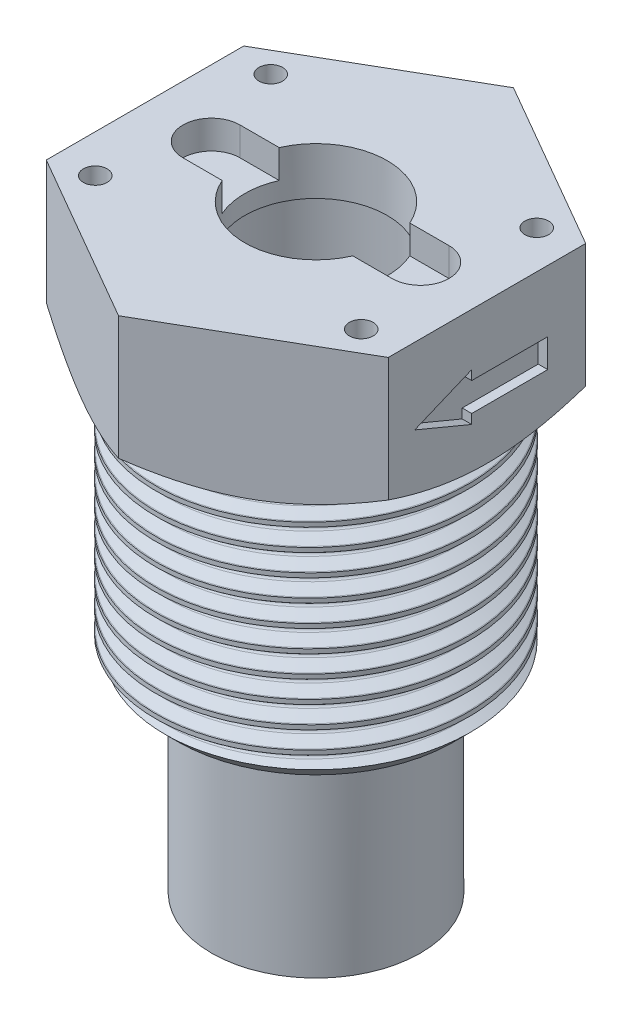
from build123d import *

# Parameters (mm, degrees)
SKETCH_1_W             = 11
SKETCH_1_H             = 65
SKETCH_8_R             = 18.027171515
CUT_EXTRUDE_8_DEPTH    = 2
SKETCH_10_R            = 9.5
CUT_EXTRUDE_10_DEPTH   = 58
SKETCH_11_R            = 7.5
CUT_EXTRUDE_11_DEPTH   = 6
SKETCH_25_R            = 9.5
EXTRUDE_4_DEPTH        = 15
WRAP_START             = -33
WRAP_1_DEPTH           = 1
SKETCH_20_R            = 16.5
SKETCH_20_R_2          = 11
EXTRUDE_3_DEPTH        = 27
CHAMFER_1_SIZE         = 2
SWEEP_2_PITCH          = 2.309
CUT_EXTRUDE_12_DEPTH   = 3
HOLE_WIZARD_M3_1_D     = 2.5
HOLE_WIZARD_M3_1_DEPTH = 10.5
HOLE_WIZARD_M3_1_TIP   = 0.751075774


# Read off the part's stored shape, not the designer's step: 包覆1
with BuildPart() as part:
    # 草图1 → 旋转1 (revolve)
    with BuildSketch(Plane.XY, mode=Mode.PRIVATE) as revolve_1_sk:
        with Locations((5.5, 32.5)):
            Rectangle(SKETCH_1_W, SKETCH_1_H)
    revolve(revolve_1_sk.sketch.rotate(Axis((0, 65, 0), (0, -1, 0)), 180), axis=Axis((0, 65, 0), (0, -1, 0)))

    # 草图8 → 切除-拉伸8 (cut)
    with BuildSketch(Plane.XZ):
        Circle(SKETCH_8_R)
    extrude(amount=-CUT_EXTRUDE_8_DEPTH, mode=Mode.SUBTRACT)

    # 草图10 → 切除-拉伸10 (cut)
    with BuildSketch(Plane.XZ.offset(-2)):
        Circle(SKETCH_10_R)
    extrude(amount=-CUT_EXTRUDE_10_DEPTH, mode=Mode.SUBTRACT)

    # 草图11 → 切除-拉伸11 (cut)
    with BuildSketch(Plane(origin=(0, 65, 0), x_dir=(1, 0, 0), z_dir=(0, 1, 0))):
        with Locations(Location((0, 0, 0), (0, 0, 180))):
            Circle(SKETCH_11_R)
    extrude(amount=-CUT_EXTRUDE_11_DEPTH, mode=Mode.SUBTRACT)

    # 草图25 → 凸台-拉伸4 (add)
    with BuildSketch(Plane(origin=(0, 50, 0), x_dir=(1, 0, 0), z_dir=(0, 1, 0))):
        Polygon((0, 20.784609691), (-18, 10.392304845), (-18, -10.392304845), (0, -20.784609691), (18, -10.392304845), (18, 10.392304845), align=None)
        Circle(SKETCH_25_R, mode=Mode.SUBTRACT)
    extrude(amount=EXTRUDE_4_DEPTH)

    # 包覆1 outline → 包覆1 (cut)
    with BuildSketch(Plane(origin=(50, 0, 0), x_dir=(0, 0, -1), z_dir=(1, 0, 0)).offset(WRAP_START)):
        Polygon((-7.607695155, 57), (-1.607695155, 54.5), (-1.607695155, 55.5), (6.392304845, 55.5), (6.392304845, 58.5), (-1.607695155, 58.5), (-1.607695155, 59.5), align=None)
    wrap_1 = extrude(amount=WRAP_1_DEPTH, mode=Mode.SUBTRACT)

    # 镜向1: 包覆1 across plane
    add(wrap_1.mirror(Plane(origin=(0, 0, 0), x_dir=(0, 0, 1), z_dir=(1, 0, 0))), mode=Mode.SUBTRACT)

    # 草图20 → 凸台-拉伸3 (add)
    with BuildSketch(Plane(origin=(0, 50, 0), x_dir=(1, 0, 0), z_dir=(0, 1, 0))):
        with Locations(Location((0, 0, 0), (0, 0, 270))):
            Circle(SKETCH_20_R)
        with Locations(Location((0, 0, 0), (0, 0, 270))):
            Circle(SKETCH_20_R_2, mode=Mode.SUBTRACT)
    extrude(amount=-EXTRUDE_3_DEPTH)

    # 草图21 → 切除-旋转2 (revolve, cut)
    with BuildSketch(Plane(origin=(0, 0, 0), x_dir=(0, 0, -1), z_dir=(1, 0, 0)), mode=Mode.PRIVATE) as cut_revolve_2_sk:
        Polygon((20.784609691, 52), (20.784609691, 50), (17.784609691, 50), align=None)
    revolve(cut_revolve_2_sk.sketch.rotate(Axis((0, 52, 0), (0, 1, 0)), 180), axis=Axis((0, 52, 0), (0, 1, 0)), mode=Mode.SUBTRACT)

    # 倒角1
    chamfer_1_edges = [part.edges().sort_by_distance(p)[0] for p in [
        (0, 23, -16.5),
    ]]
    chamfer(chamfer_1_edges, length=CHAMFER_1_SIZE)

    # 切除-扫描2: the profile of 草图24 screwed along a right-hand helix of 12 turns, 10 arcs to a turn; built about Z, then put on its axis
    sweep_2_z = Axis((0, 0, 0), (0, 0, 1))
    sweep_2_corners = [(16.42937431, 0, -0.590182434), (15.292853797, 0, -1.181817566), (15.122228107, 0, -1.463), (15.292853797, 0, -1.744182434), (16.42937431, 0, -2.335817566), (16.6, 0, -2.617), (16.6, 0, -0.309)]
    with BuildLine(mode=Mode.PRIVATE) as sweep_2_profile:
        Line(sweep_2_corners[0], sweep_2_corners[1])
        Line(sweep_2_corners[3], sweep_2_corners[4])
        Line(sweep_2_corners[5], sweep_2_corners[6])
        ThreePointArc((15.292853797, 0, -1.181817566), (15.168221044, 0, -1.298548877), (15.122228107, 0, -1.463))
        ThreePointArc((15.122228107, 0, -1.463), (15.168221044, 0, -1.627451123), (15.292853797, 0, -1.744182434))
        ThreePointArc((16.42937431, 0, -2.335817566), (16.554007063, 0, -2.452548877), (16.6, 0, -2.617))
        ThreePointArc((16.6, 0, -0.309), (16.554007063, 0, -0.473451123), (16.42937431, 0, -0.590182434))
    sweep_2_cap = Face(sweep_2_profile.wire())
    sweep_2_arcs = [((15.292853797, 0, -1.181817566), (15.122228107, 0, -1.270639678), (15.122228107, 0, -1.463), (1, 0.854911870672946, 1)), ((15.122228107, 0, -1.463), (15.122228107, 0, -1.655360322), (15.292853797, 0, -1.744182434), (1, 0.854911870672946, 1)), ((16.42937431, 0, -2.335817566), (16.6, 0, -2.424639678), (16.6, 0, -2.617), (1, 0.8549118706729456, 1)), ((16.6, 0, -0.309), (16.6, 0, -0.501360322), (16.42937431, 0, -0.590182434), (1, 0.8549118706729619, 1))]  # start, shoulder, end, weights
    sweep_2_turn_angles = [0, 18, 36, 54, 72, 90, 108, 126, 144, 162, 180, 198, 216, 234, 252, 270, 288, 306, 324, 342, 360]
    sweep_2_turn_weights = [1, 0.9510565162951535, 1, 0.9510565162951535, 1, 0.9510565162951535, 1, 0.9510565162951535, 1, 0.9510565162951535, 1, 0.9510565162951535, 1, 0.9510565162951535, 1, 0.9510565162951535, 1, 0.9510565162951535, 1, 0.9510565162951535, 1]
    sweep_2_turn_rails = [Edge.make_bspline([Vector(p[0], p[1], 0).rotate(sweep_2_z, sweep_2_turn_angles[k]) / sweep_2_turn_weights[k] + Vector(0, 0, p[2] + SWEEP_2_PITCH * sweep_2_turn_angles[k] / 360) for k in range(21)], [0, 0, 0, 1, 1, 2, 2, 3, 3, 4, 4, 5, 5, 6, 6, 7, 7, 8, 8, 9, 9, 10, 10, 10], 2, sweep_2_turn_weights) for p in sweep_2_corners]
    sweep_2_turn_sides = [*[Face.make_surface_from_curves(sweep_2_turn_rails[p[0]], sweep_2_turn_rails[p[1]]) for p in [(0, 1), (3, 4), (5, 6)]], *[Face.make_bezier_surface([[Vector(p[j][0], p[j][1], 0).rotate(sweep_2_z, sweep_2_turn_angles[2 * i + k]) / sweep_2_turn_weights[2 * i + k] + Vector(0, 0, p[j][2] + SWEEP_2_PITCH * sweep_2_turn_angles[2 * i + k] / 360) for k in range(3)] for j in range(3)], [[p[3][j] * sweep_2_turn_weights[2 * i + k] for k in range(3)] for j in range(3)]) for p in sweep_2_arcs for i in range(10)]]
    sweep_2 = Plane(origin=(0, 23, 0), x_dir=(0, 0, -1), z_dir=(0, 1, 0)) * Solid(Shell([*[p.moved(Location((0, 0, SWEEP_2_PITCH * i))) for i in range(12) for p in sweep_2_turn_sides], sweep_2_cap, sweep_2_cap.rotate(sweep_2_z, 4320).moved(Location((0, 0, SWEEP_2_PITCH * 4320 / 360)))]))
    add(sweep_2, mode=Mode.SUBTRACT)

    # 草图27 → 切除-拉伸12 (cut)
    with BuildSketch(Plane(origin=(0, 65, 0), x_dir=(1, 0, 0), z_dir=(0, 1, 0))):
        with BuildLine():
            Line((-11, 3), (11, 3))
            ThreePointArc((11, 3), (14, 0), (11, -3))
            Line((11, -3), (-11, -3))
            ThreePointArc((-11, -3), (-14, 0), (-11, 3))
        make_face()
    extrude(amount=-CUT_EXTRUDE_12_DEPTH, mode=Mode.SUBTRACT)

    # M3 螺纹孔1
    with Locations(Plane(origin=(0, 65, 0), x_dir=(1, 0, 0), z_dir=(0, 1, 0))):
        with Locations((-14, 9.237604307), (-14, -9.237604307), (14, -9.237604307), (14, 9.237604307)):
            Hole(HOLE_WIZARD_M3_1_D / 2, depth=HOLE_WIZARD_M3_1_DEPTH)
            with Locations((0, 0, -(HOLE_WIZARD_M3_1_DEPTH + HOLE_WIZARD_M3_1_TIP / 2))):  # 118° drill point
                Cone(0, HOLE_WIZARD_M3_1_D / 2, HOLE_WIZARD_M3_1_TIP, mode=Mode.SUBTRACT)


solid = part.part
